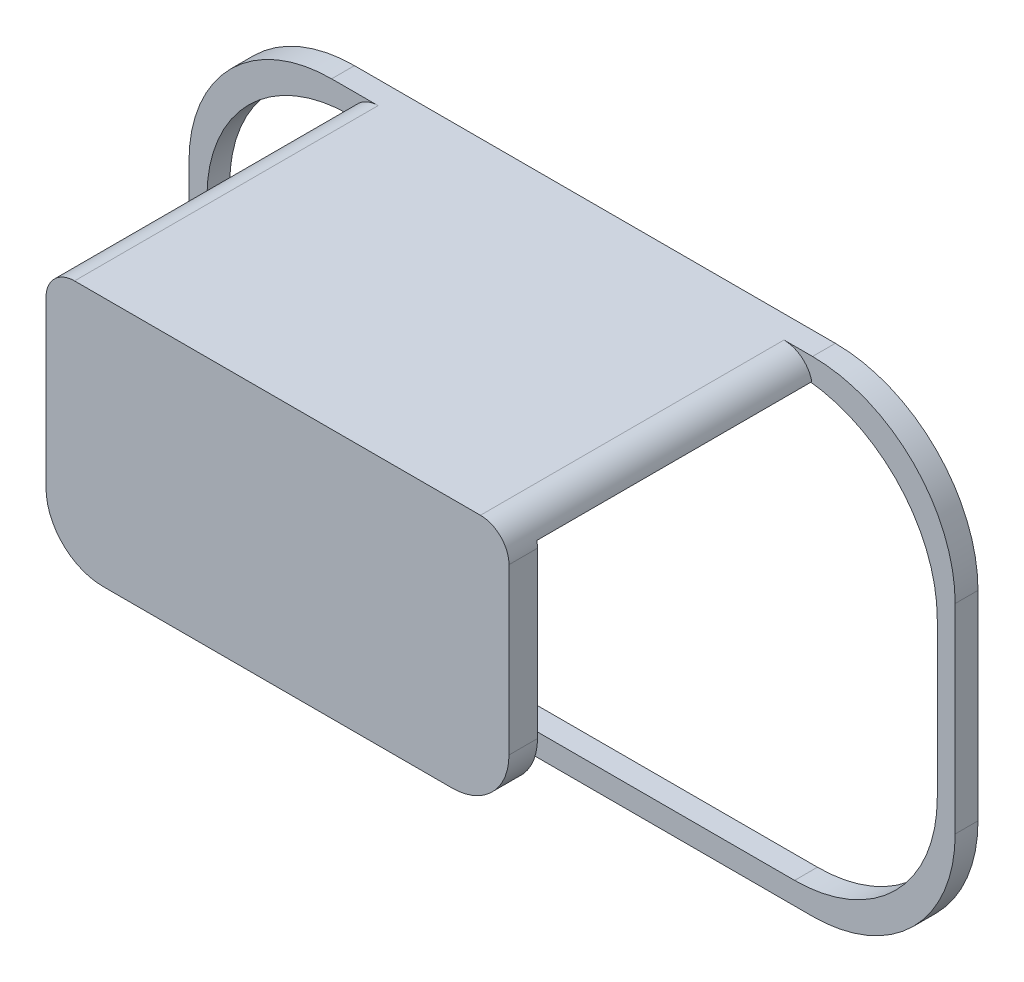
from build123d import *

# Parameters (mm, degrees)
BOSS_EXTRUDE1_DEPTH = 4
FILLET1_R           = 25
SKETCH3_W           = 81.141662503
SKETCH3_H           = 3.889724504
BOSS_EXTRUDE3_DEPTH = 57.201055289
SKETCH4_W           = 81.141662503
SKETCH4_H           = 5
BOSS_EXTRUDE4_DEPTH = 40
FILLET2_R           = 10
FILLET3_R           = 5


with BuildPart() as part:
    # Sketch1 → Boss-Extrude1 (new body)
    with BuildSketch(Plane.XY):
        Polygon((-71.429943593, 36.204490704), (56.570056407, 36.204490704), (59.71171891, 40.094215208), (-74.571606096, 40.094215208), align=None)
        Polygon((56.570056407, 36.204490704), (56.570056407, -40.995509296), (59.71171891, -44.8852338), (59.71171891, 40.094215208), align=None)
        Polygon((56.570056407, -40.995509296), (59.71171891, -44.8852338), (-74.571606096, -44.8852338), (-74.571606096, 40.094215208), (-71.429943593, 36.204490704), (-71.429943593, -40.995509296), align=None)
    extrude(amount=BOSS_EXTRUDE1_DEPTH)

    # Fillet1
    fillet1_edges = [part.edges().sort_by_distance(p)[0] for p in [
        (-71.429943593, 36.204490704, 2),
        (-71.429943593, -40.995509296, 2),
        (56.570056407, -40.995509296, 2),
        (56.570056407, 36.204490704, 2),
        (-74.571606096, -44.8852338, 2),
        (-74.571606096, 40.094215208, 2),
        (59.71171891, 40.094215208, 2),
        (59.71171891, -44.8852338, 2),
    ]]
    fillet(fillet1_edges, radius=FILLET1_R)

    # Sketch3 → Boss-Extrude3 (add)
    with BuildSketch(Plane(origin=(0, 0, 0), x_dir=(-1, 0, 0), z_dir=(0, 0, -1))):
        with Locations((5.859112342, 38.149352956)):
            Rectangle(SKETCH3_W, SKETCH3_H)
    extrude(amount=-BOSS_EXTRUDE3_DEPTH)

    # Sketch4 → Boss-Extrude4 (add)
    with BuildSketch(Plane(origin=(0, 36.204490704, 0), x_dir=(-1, 0, 0), z_dir=(0, -1, 0))):
        with Locations((5.859112342, -54.701055289)):
            Rectangle(SKETCH4_W, SKETCH4_H)
    extrude(amount=BOSS_EXTRUDE4_DEPTH)

    # Fillet2
    fillet2_edges = [part.edges().sort_by_distance(p)[0] for p in [
        (-46.429943593, -3.795509296, 54.701055289),
        (34.71171891, -3.795509296, 54.701055289),
    ]]
    fillet(fillet2_edges, radius=FILLET2_R)

    # Fillet3
    # the kernel refuses this fillet: 5 mm, written as the material it takes off along each edge
    with BuildSketch(Plane(origin=(34.71171891, 40.094215208, 4), x_dir=(-1, 0, 0), z_dir=(0, 0, 1)), Plane(origin=(-46.429943593, 40.094215208, 4), x_dir=(0, -1, 0), z_dir=(0, 0, 1))) as fillet3_piece_1:
        with BuildLine():
            CenterArc((FILLET3_R, FILLET3_R), FILLET3_R, 180, 90)
            Line((0, FILLET3_R), (0, 0))
            Line((0, 0), (FILLET3_R, 0))
        make_face()
    extrude(amount=65.701055289, mode=Mode.SUBTRACT)


solid = part.part
